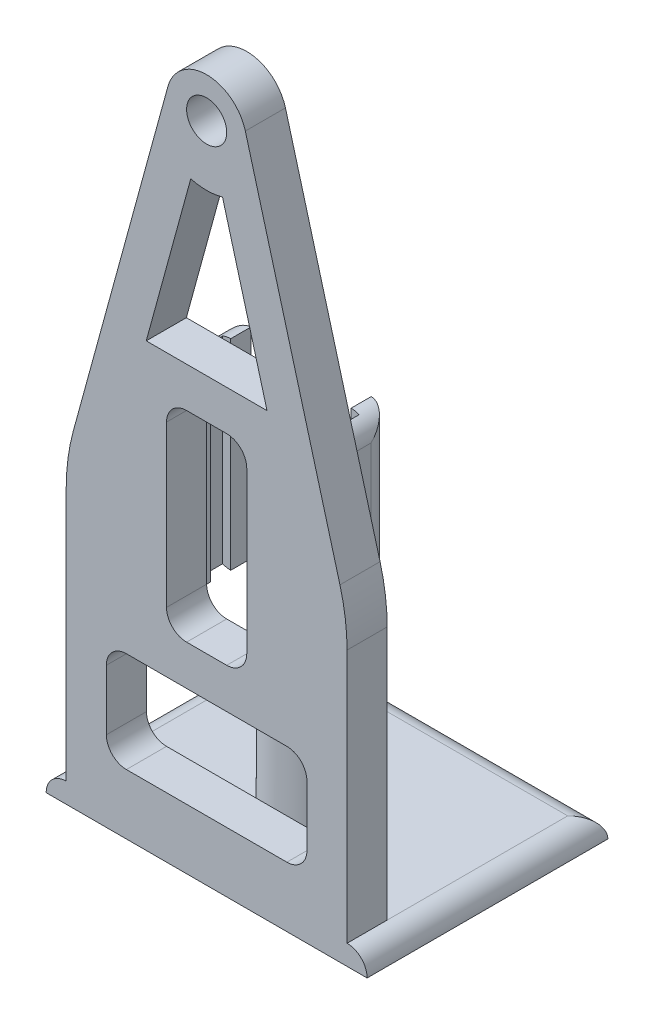
from build123d import *

# Parameters (mm, degrees)
SKETCH1_R               = 5
BOSS_EXTRUDE1_DEPTH     = 10
SKETCH2_W               = 80
SKETCH2_H               = 5
BOSS_EXTRUDE2_DEPTH     = 50
SKETCH3_W               = 5
SKETCH3_H               = 50
BOSS_EXTRUDE3_DEPTH     = 16
FILLET1_R               = 50
FILLET3_R               = 5
FILLET7_R               = 5
FILLET8_R               = 5
CUT_EXTRUDE4_DEPTH      = 32
CUT_EXTRUDE4_DEPTH_BACK = 2
SKETCH8_W               = 5
SKETCH8_H               = 50
SKETCH11_R              = 10
BOSS_EXTRUDE5_DEPTH     = 18.75
CUT_EXTRUDE9_DEPTH      = 45


with BuildPart() as part:
    # Sketch1 → Boss-Extrude1 (new body)
    with BuildSketch(Plane.XY):
        with BuildLine():
            Line((-40, 5), (-40, 0))
            Line((-40, 0), (40, 0))
            Line((40, 0), (40, 5))
            Line((40, 5), (35, 5))
            Line((35, 5), (35, 75))
            Line((35, 75), (9.645273695, 167.639828659))
            ThreePointArc((9.645273695, 167.639828659), (0, 175), (-9.645273695, 167.639828659))
            Line((-9.645273695, 167.639828659), (-35, 75))
            Line((-35, 75), (-35, 5))
            Line((-35, 5), (-40, 5))
        make_face()
        with Locations((0, 165)):
            Circle(SKETCH1_R, mode=Mode.SUBTRACT)
    extrude(amount=BOSS_EXTRUDE1_DEPTH)

    # Sketch2 → Boss-Extrude2 (add)
    with BuildSketch(Plane(origin=(0, 0, 0), x_dir=(-1, 0, 0), z_dir=(0, 0, -1))):
        with Locations((0, 2.5)):
            Rectangle(SKETCH2_W, SKETCH2_H)
    extrude(amount=BOSS_EXTRUDE2_DEPTH)

    # Sketch3 → Boss-Extrude3 (add)
    with BuildSketch(Plane(origin=(0, 0, 0), x_dir=(-1, 0, 0), z_dir=(0, 0, -1))):
        with Locations((-17.5, 75)):
            Rectangle(SKETCH3_W, SKETCH3_H)
        with Locations((17.5, 75)):
            Rectangle(SKETCH3_W, SKETCH3_H)
    extrude(amount=BOSS_EXTRUDE3_DEPTH)

    # Fillet1
    fillet1_edges = [part.edges().sort_by_distance(p)[0] for p in [
        (-35, 75, 5),
        (35, 75, 5),
    ]]
    fillet(fillet1_edges, radius=FILLET1_R)

    # Fillet3
    fillet3_edges = [part.edges().sort_by_distance(p)[0] for p in [
        (0, 5, -50),
        (-40, 5, -20),
        (40, 5, -20),
    ]]
    fillet(fillet3_edges, radius=FILLET3_R - 0.0001)  # a hair under: the kernel refuses the full size

    # Fillet7
    fillet7_edges = [part.edges().sort_by_distance(p)[0] for p in [
        (20, 75, -16),
        (20, 50, -8),
        (20, 100, -8),
    ]]
    fillet(fillet7_edges, radius=FILLET7_R - 0.0001)  # a hair under: the kernel refuses the full size

    # Fillet8
    fillet8_edges = [part.edges().sort_by_distance(p)[0] for p in [
        (-20, 50, -8),
        (-20, 75, -16),
        (-20, 100, -8),
    ]]
    fillet(fillet8_edges, radius=FILLET8_R - 0.0001)  # a hair under: the kernel refuses the full size

    # Sketch8 → Cut-Extrude4 (cut, two sides: drawn at the far end of the back side and taken through both)
    with BuildSketch(Plane(origin=(-15, 0, 0), x_dir=(0, 0, -1), z_dir=(1, 0, 0)).offset(-CUT_EXTRUDE4_DEPTH_BACK)):
        with Locations((8.5, 75)):
            Rectangle(SKETCH8_W, SKETCH8_H)
    extrude(amount=CUT_EXTRUDE4_DEPTH + CUT_EXTRUDE4_DEPTH_BACK, mode=Mode.SUBTRACT)

    # Sketch11 → Boss-Extrude5 (add)
    with BuildSketch(Plane(origin=(0, 5, 0), x_dir=(1, 0, 0), z_dir=(0, 1, 0))):
        with Locations(Location((0, 16.5, 0), (0, 0, 90))):
            Circle(SKETCH11_R)
    extrude(amount=BOSS_EXTRUDE5_DEPTH)

    # Sketch14 → Cut-Extrude9 (cut)
    with BuildSketch(Plane(origin=(0, 0, 0), x_dir=(-1, 0, 0), z_dir=(0, 0, -1))):
        with BuildLine():
            Line((-25, 35), (-25, 20))
            ThreePointArc((-25, 20), (-23.535533906, 16.464466094), (-20, 15))
            Line((-20, 15), (20, 15))
            ThreePointArc((20, 15), (23.535533906, 16.464466094), (25, 20))
            Line((25, 20), (25, 35))
            ThreePointArc((25, 35), (23.535533906, 38.535533906), (20, 40))
            Line((20, 40), (-20, 40))
            ThreePointArc((-20, 40), (-23.535533906, 38.535533906), (-25, 35))
        make_face()
        with BuildLine():
            ThreePointArc((-3.959742989, 150.532089458), (0, 150), (3.959742989, 150.532089458))
            Line((3.959742989, 150.532089458), (15.05302813, 110))
            Line((15.05302813, 110), (-15.05302813, 110))
            Line((-15.05302813, 110), (-3.959742989, 150.532089458))
        make_face()
        with BuildLine():
            Line((-10, 95), (-10, 55))
            ThreePointArc((-10, 55), (-8.535533906, 51.464466094), (-5, 50))
            Line((-5, 50), (5, 50))
            ThreePointArc((5, 50), (8.535533906, 51.464466094), (10, 55))
            Line((10, 55), (10, 95))
            ThreePointArc((10, 95), (8.535533906, 98.535533906), (5, 100))
            Line((5, 100), (-5, 100))
            ThreePointArc((-5, 100), (-8.535533906, 98.535533906), (-10, 95))
        make_face()
    extrude(amount=-CUT_EXTRUDE9_DEPTH, mode=Mode.SUBTRACT)


solid = part.part
